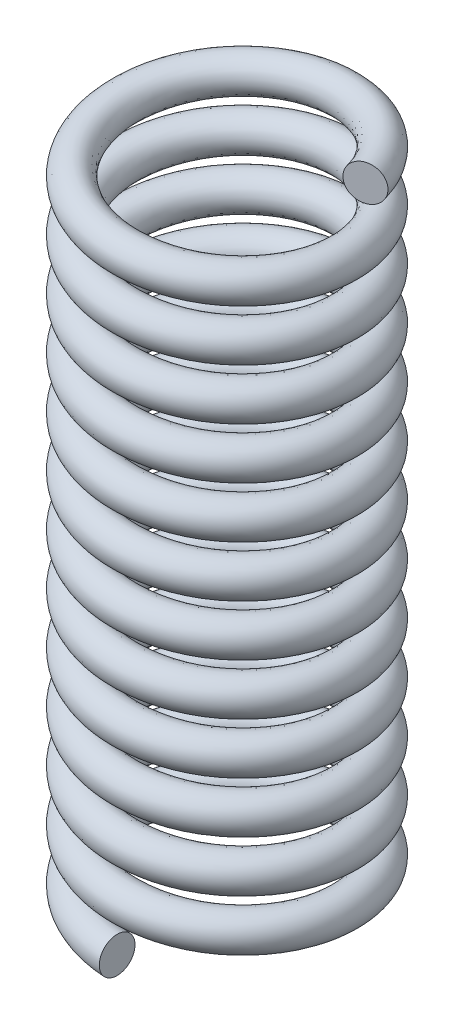
from build123d import *

# Parameters (mm, degrees)
SWEEP2_PITCH  = 1
SWEEP2_HEIGHT = 12.7
SWEEP2_RADIUS = 2.15
SKETCH4_R     = 0.35


with BuildPart() as part:
    # Sweep2: sweep along a helix
    with BuildLine() as sweep2_path:
        Helix(SWEEP2_PITCH, SWEEP2_HEIGHT, SWEEP2_RADIUS, center=(0, 0, 0), direction=(0, 1, 0), lefthand=True)
    # Sketch4 → Sweep2 (sweep)
    with BuildSketch(Plane.XY):
        with Locations((-2.150000074, 0.249999975)):
            Circle(SKETCH4_R)
    sweep(path=sweep2_path.line, is_frenet=True)


solid = part.part
